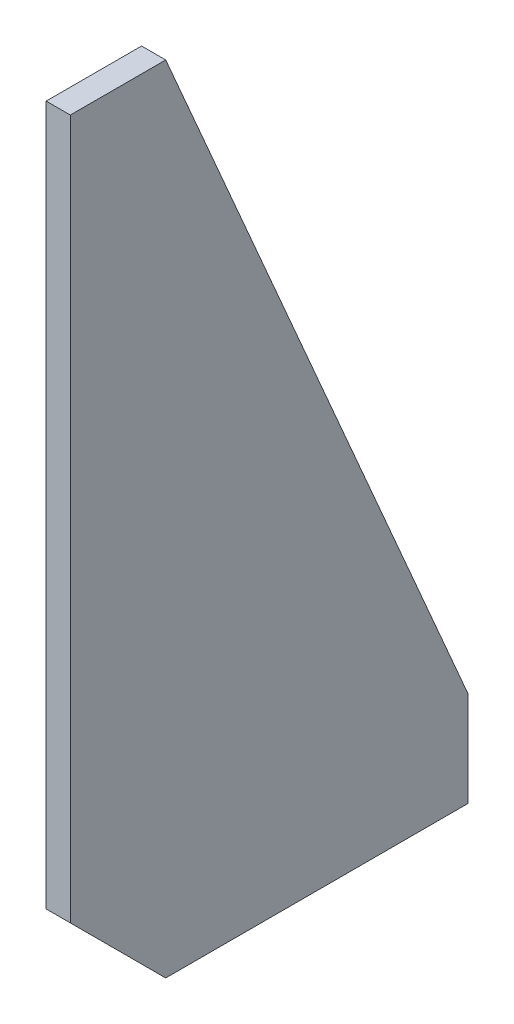
from build123d import *

# Parameters (mm, degrees)
BASE_FLANGE1_DEPTH = 3.03784


# Sheet-metal steps are written as plain solids
with BuildPart() as part:
    # Sketch1 → Base-Flange1 (new body)
    with BuildSketch(Plane(origin=(0, 0, 0), x_dir=(0, 0, -1), z_dir=(1, 0, 0))):
        Polygon((12, 0), (0, 12), (0, 100), (12, 100), (50, 12), (50, 0), align=None)
    extrude(amount=-BASE_FLANGE1_DEPTH)


solid = part.part
